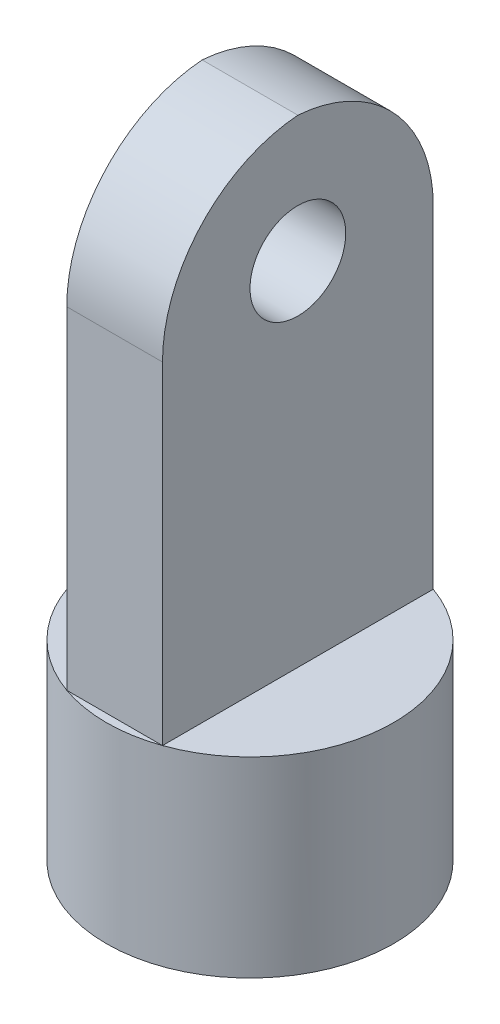
from build123d import *

# Parameters (mm, degrees)
SKETCH1_R           = 7.5
BOSS_EXTRUDE1_DEPTH = 10
SKETCH2_R           = 6.25
CUT_EXTRUDE2_DEPTH  = 7.5
SKETCH3_W           = 5
SKETCH3_H           = 14.142135624
BOSS_EXTRUDE2_DEPTH = 25
SKETCH4_R           = 2.5
CUT_EXTRUDE3_DEPTH  = 5
FILLET1_R           = 7.65


with BuildPart() as part:
    # Sketch1 → Boss-Extrude1 (new body)
    with BuildSketch(Plane(origin=(0, 0, 0), x_dir=(1, 0, 0), z_dir=(0, 1, 0))):
        with Locations(Location((0, 0, 0), (0, 0, 270))):
            Circle(SKETCH1_R)
    extrude(amount=BOSS_EXTRUDE1_DEPTH)

    # Sketch2 → Cut-Extrude2 (cut)
    with BuildSketch(Plane.XZ):
        with Locations(Location((0, 0, 0), (0, 0, 270))):
            Circle(SKETCH2_R)
    extrude(amount=-CUT_EXTRUDE2_DEPTH, mode=Mode.SUBTRACT)

    # Sketch3 → Boss-Extrude2 (add)
    with BuildSketch(Plane(origin=(0, 10, 0), x_dir=(1, 0, 0), z_dir=(0, 1, 0))):
        Rectangle(SKETCH3_W, SKETCH3_H)
    extrude(amount=BOSS_EXTRUDE2_DEPTH)

    # Sketch4 → Cut-Extrude3 (cut)
    with BuildSketch(Plane(origin=(2.5, 0, 0), x_dir=(0, 0, -1), z_dir=(1, 0, 0))):
        with Locations((0, 28.391835492)):
            Circle(SKETCH4_R)
    extrude(amount=-CUT_EXTRUDE3_DEPTH, mode=Mode.SUBTRACT)

    # Fillet1
    # the kernel refuses this fillet: 7.65 mm, written as the material it takes off along each edge
    with BuildSketch(Plane(origin=(21.625, 35, -7.071067812), x_dir=(0, -1, 0), z_dir=(-1, 0, 0)), Plane(origin=(-21.625, 35, 7.071067812), x_dir=(0, -1, 0), z_dir=(1, 0, 0))) as fillet1_piece_1:
        with BuildLine():
            CenterArc((FILLET1_R, FILLET1_R), FILLET1_R, 180, 90)
            Line((0, FILLET1_R), (0, 0))
            Line((0, 0), (FILLET1_R, 0))
        make_face()
    extrude(amount=43.25, mode=Mode.SUBTRACT)


solid = part.part
